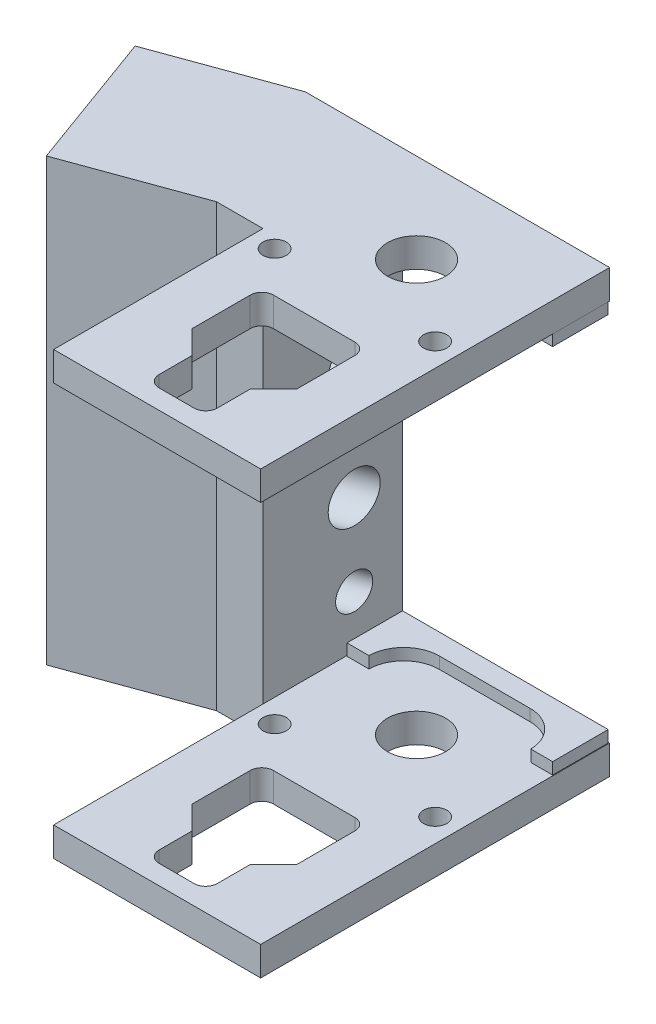
from build123d import *

# Parameters (mm, degrees)
SKETCH1_W                  = 17.8
SKETCH1_H                  = 30
SKETCH1_R                  = 1
SKETCH1_R_2                = 2.5
BOSS_EXTRUDE1_DEPTH        = 2.5
SKETCH2_W                  = 9
SKETCH2_H                  = 6
SKETCH2_W_2                = 5
SKETCH2_H_2                = 5.830943002
CUT_EXTRUDE1_DEPTH         = 20.350968968
CHAMFER1_SIZE              = 2
FILLET1_R                  = 1
BOSS_EXTRUDE2_DEPTH        = 1
SKETCH4_W                  = 12
SKETCH4_H                  = 18.95
BOSS_EXTRUDE3_DEPTH        = 4
BOSS_EXTRUDE4_DEPTH        = 37.9
SKETCH6_W                  = 12.770133269
SKETCH6_H                  = 37.9
BOSS_EXTRUDE5_DEPTH        = 11.41
F_3_0_MM_DOWEL_HOLES1_D    = 3
F_4_2_4_2_DIAMETER_HOLE1_D = 4.2


with BuildPart() as part:
    # Sketch1 → Boss-Extrude1 (new body)
    with BuildSketch(Plane(origin=(0, 0, 0), x_dir=(1, 0, 0), z_dir=(0, 1, 0))):
        with Locations((0, -2)):
            Rectangle(SKETCH1_W, SKETCH1_H)
        with Locations(Location((-6.9, 0, 0), (0, 0, 270))):
            Circle(SKETCH1_R, mode=Mode.SUBTRACT)
        with Locations(Location((6.9, 0, 0), (0, 0, 270))):
            Circle(SKETCH1_R, mode=Mode.SUBTRACT)
        with Locations(Location((0, 5.3, 0), (0, 0, 270))):
            Circle(SKETCH1_R_2, mode=Mode.SUBTRACT)
    extrude(amount=BOSS_EXTRUDE1_DEPTH)

    # Sketch2 → Cut-Extrude1 (cut, through all)
    with BuildSketch(Plane(origin=(0, 2.5, 0), x_dir=(1, 0, 0), z_dir=(0, 1, 0))):
        with Locations((0, -6.5)):
            Rectangle(SKETCH2_W, SKETCH2_H)
        with Locations((0, -12.415471501)):
            Rectangle(SKETCH2_W_2, SKETCH2_H_2)
    extrude(amount=-CUT_EXTRUDE1_DEPTH, mode=Mode.SUBTRACT)

    # Chamfer1
    chamfer1_edges = [part.edges().sort_by_distance(p)[0] for p in [
        (2.5, 1.25, 9.5),
        (-2.5, 1.25, 9.5),
    ]]
    chamfer(chamfer1_edges, length=CHAMFER1_SIZE - 0.0001)  # a hair under: the kernel refuses the full size

    # Fillet1
    fillet1_edges = [part.edges().sort_by_distance(p)[0] for p in [
        (4.5, 1.25, 3.5),
        (2.5, 1.25, 15.330943002),
        (-2.5, 1.25, 15.330943002),
        (-4.5, 1.25, 3.5),
    ]]
    fillet(fillet1_edges, radius=FILLET1_R)

    # Sketch3 → Boss-Extrude2 (add)
    with BuildSketch(Plane(origin=(0, 2.5, 0), x_dir=(1, 0, 0), z_dir=(0, 1, 0))):
        with BuildLine():
            Line((8.84, 8.16), (6.959390471, 8.16))
            ThreePointArc((6.959390471, 8.16), (6.042112051, 10.284532913), (3.900010938, 11.159999998))
            Line((3.900010938, 11.159999998), (-3.900010938, 11.159999998))
            ThreePointArc((-3.900010938, 11.159999998), (-6.04211205, 10.284532912), (-6.959390471, 8.16))
            Line((-6.959390471, 8.16), (-8.84, 8.16))
            Line((-8.84, 8.16), (-8.84, 12.94))
            Line((-8.84, 12.94), (8.84, 12.94))
            Line((8.84, 12.94), (8.84, 8.16))
        make_face()
    extrude(amount=BOSS_EXTRUDE2_DEPTH)

    # Sketch4 → Boss-Extrude3 (add)
    with BuildSketch(Plane.ZY.offset(8.9)):
        with Locations((-7, 9.475)):
            Rectangle(SKETCH4_W, SKETCH4_H)
    extrude(amount=BOSS_EXTRUDE3_DEPTH)

    # Mirror2: part across plane


with BuildPart() as part_1:
    add(part.part)
    add(part.part.mirror(Plane.ZX.offset(18.95)))

    # Sketch5 → Boss-Extrude4 (add)
    with BuildSketch(Plane(origin=(0, 37.9, 0), x_dir=(1, 0, 0), z_dir=(0, 1, 0))):
        Polygon((-12.9, 1), (-17.267642811, 13), (-12.9, 13), align=None)
    extrude(amount=-BOSS_EXTRUDE4_DEPTH)

    # Sketch6 → Boss-Extrude5 (add)
    with BuildSketch(Plane(origin=(-11.069592853, 0, 4.029002304), x_dir=(0.3420201433256634, 0, 0.9396926207859103), z_dir=(-0.9396926207859103, 0, 0.3420201433256634))):
        with Locations((-11.736819105, 18.95)):
            Rectangle(SKETCH6_W, SKETCH6_H)
    extrude(amount=BOSS_EXTRUDE5_DEPTH)

    # Ø3.0 mm Dowel Holes1 (through all)
    with Locations(Plane(origin=(-23.72675034, 0, 2.614356121), x_dir=(-0.34202014332566333, 0, -0.9396926207859103), z_dir=(-0.9396926207859104, 0, 0.3420201433256634))):
        with Locations((5.693417073, -6.95), (5.693417073, -30.95)):
            Hole(F_3_0_MM_DOWEL_HOLES1_D / 2)

    # Ø4.2 (4.2) Diameter Hole1 (through all)
    with Locations(Plane(origin=(-21.791485656, 0, 7.931452139), x_dir=(0.34202014332566333, 0, 0.9396926207859103), z_dir=(-0.9396926207859104, 0, 0.3420201433256634))):
        with Locations((-11.35175247, 13.95), (-11.35175247, 23.95)):
            Hole(F_4_2_4_2_DIAMETER_HOLE1_D / 2)


solid = part_1.part
